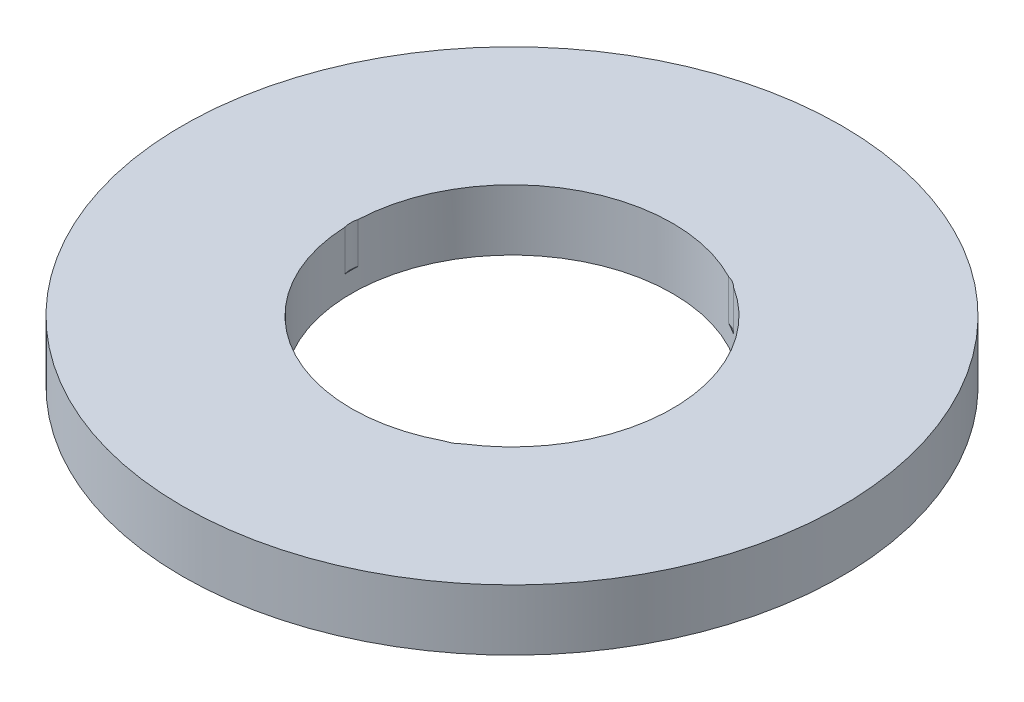
from build123d import *

# Parameters (mm, degrees)
SKETCH1_R           = 97.5
BOSS_EXTRUDE1_DEPTH = 18
SKETCH2_R           = 47.5
CUT_EXTRUDE1_DEPTH  = 140.055744218
SKETCH3_R           = 7.445020378
CUT_EXTRUDE2_DEPTH  = 12.006626498
CIRPATTERN1_COUNT   = 3


with BuildPart() as part:
    # Sketch1 → Boss-Extrude1 (new body)
    with BuildSketch(Plane(origin=(0, 0, 0), x_dir=(1, 0, 0), z_dir=(0, 1, 0))):
        Circle(SKETCH1_R)
    extrude(amount=BOSS_EXTRUDE1_DEPTH)

    # Sketch2 → Cut-Extrude1 (cut, through all)
    with BuildSketch(Plane(origin=(0, 0, 0), x_dir=(1, 0, 0), z_dir=(0, 1, 0))):
        Circle(SKETCH2_R)
    extrude(amount=CUT_EXTRUDE1_DEPTH, mode=Mode.SUBTRACT)

    # Sketch3 → Cut-Extrude2 (cut)
    with BuildSketch(Plane(origin=(0, 18, 0), x_dir=(1, 0, 0), z_dir=(0, 1, 0))):
        with Locations((-40.276828654, 0)):
            Circle(SKETCH3_R)
    cut_extrude2 = extrude(amount=-CUT_EXTRUDE2_DEPTH, mode=Mode.SUBTRACT)

    # CirPattern1: Cut-Extrude2 ×3 about axis
    cirpattern1_axis = Axis((0, 0, 0), (0, 1, 0))
    for i in range(1, CIRPATTERN1_COUNT):
        add(cut_extrude2.rotate(cirpattern1_axis, i * 360 / CIRPATTERN1_COUNT), mode=Mode.SUBTRACT)


solid = part.part
